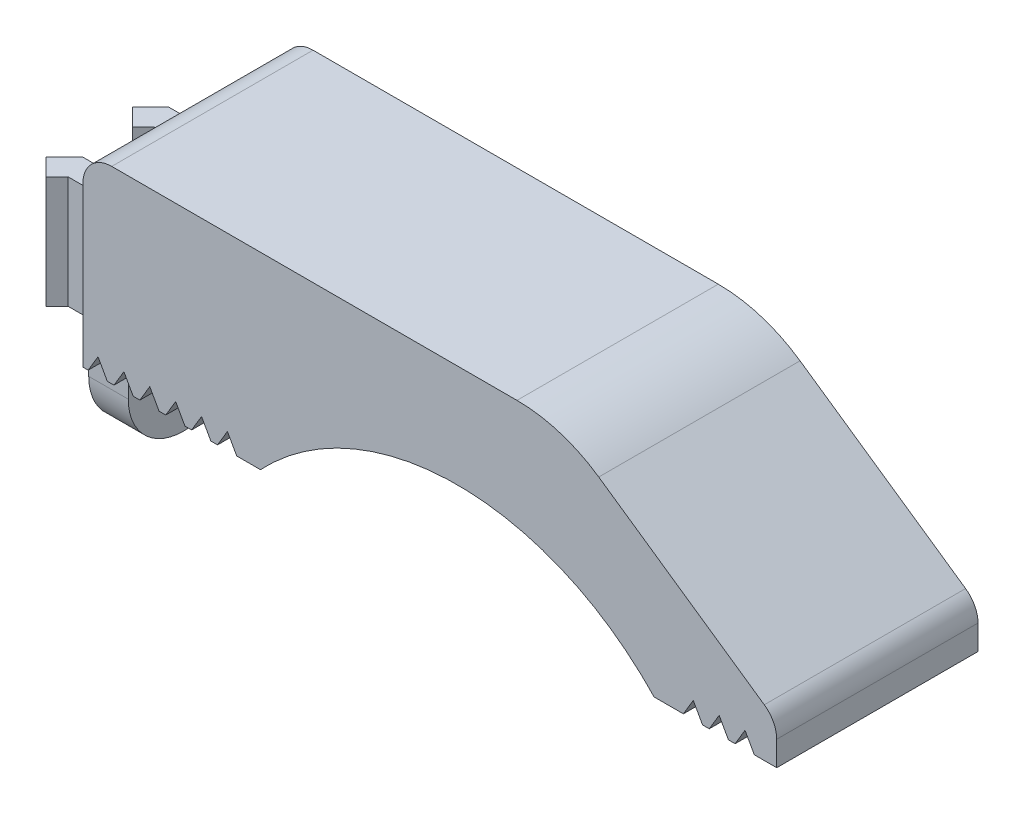
from build123d import *

# Parameters (mm, degrees)
EXTRUDE_1_DEPTH              = 10
CUT_EXTRUDE_1_DEPTH          = 34.383433003
FILLET_1_SIZE                = 4
FILLET_1_SIZE_2              = 6
CUT_EXTRUDE_2_DEPTH          = 34.383433056
CUT_EXTRUDE_2_DEPTH_BACK     = 34.383433056
SKETCH_3_W                   = 58.405721138
SKETCH_3_H                   = 2.2
SKETCH_4_W                   = 2.75
SKETCH_4_H                   = 7.7
EXTRUDE_2_DEPTH              = 7.35
SKETCH_5_R                   = 0.75
CUT_EXTRUDE_3_DEPTH          = 54.030431013
FILLET_2_R                   = 3.85
CORTAR_EXTRUIR1_DEPTH        = 33.791669707
SALIENTE_EXTRUIR1_DEPTH      = 7.7
CROQUIS2_R                   = 20
CORTAR_EXTRUIR3_DEPTH        = 35.438086687
SALIENTE_EXTRUIR4_DEPTH      = 7
SALIENTE_EXTRUIR4_DEPTH_BACK = 7
CORTAR_EXTRUIR4_DEPTH        = 37.368830262
REDONDEO3_R                  = 2
REDONDEO4_R                  = 10


# Some blends are built 0.0001 mm under size
with BuildPart() as part:
    # 草图1 → 凸台-拉伸1 (new body)
    with BuildSketch(Plane(origin=(0, 0, 0), x_dir=(1, 0, 0), z_dir=(0, 1, 0))):
        Polygon((27.5, 3.85), (-27.5, 3.85), (-29.64, 3.85), (-30.905721138, 2.584278862), (-29.70363961, 1.382197334), (-28.935836944, 2.15), (-27.5, 2.15), (-27.5, -2.15), (-29.64, -2.15), (-30.905721138, -3.415721138), (-29.70363961, -4.617802666), (-28.935836944, -3.85), (-27.5, -3.85), (27.5, -3.85), align=None)
    extrude(amount=EXTRUDE_1_DEPTH)

    # 草图2 → 切除-拉伸1 (cut, through all)
    with BuildSketch(Plane.XY.offset(3.85)):
        with BuildLine():
            Line((-18.935836944, 0), (21.5, 0))
            ThreePointArc((21.5, 0), (1.282081528, 3.70613757), (-18.935836944, 0))
        make_face()
    extrude(amount=-CUT_EXTRUDE_1_DEPTH, mode=Mode.SUBTRACT)

    # 圆角1
    # an asymmetric fillet: 6, 4 mm, written as the material it takes off along each edge
    with BuildSketch(Plane(origin=(27.5, 0, 18.85), x_dir=(-1, 0, 0), z_dir=(0, 0, -1))) as fillet_1_piece_1:
        with BuildLine():
            Bezier((FILLET_1_SIZE, 0), (0, 0), (0, FILLET_1_SIZE_2), weights=[1, 0.707106781, 1])
            Line((0, FILLET_1_SIZE_2), (0, 0))
            Line((0, 0), (FILLET_1_SIZE, 0))
        make_face()
    extrude(amount=37.7, mode=Mode.SUBTRACT)

    # 草图3 → 切除-拉伸2 (cut, two sides: drawn at the far end of the back side and taken through both)
    with BuildSketch(Plane.XY.offset(3.85).offset(-CUT_EXTRUDE_2_DEPTH_BACK)):
        with Locations((-1.702860569, 8.9)):
            Rectangle(SKETCH_3_W, SKETCH_3_H)
    extrude(amount=CUT_EXTRUDE_2_DEPTH + CUT_EXTRUDE_2_DEPTH_BACK, mode=Mode.SUBTRACT)

    # 草图4 → 凸台-拉伸2 (add)
    with BuildSketch(Plane.XZ):
        with Locations((-26.125, 0)):
            Rectangle(SKETCH_4_W, SKETCH_4_H)
    extrude(amount=EXTRUDE_2_DEPTH)

    # 草图5 → 切除-拉伸3 (cut, through all)
    with BuildSketch(Plane(origin=(-24.75, 0, 0), x_dir=(0, 0, -1), z_dir=(1, 0, 0))):
        with Locations((0, -3.5)):
            Circle(SKETCH_5_R)
    extrude(amount=-CUT_EXTRUDE_3_DEPTH, mode=Mode.SUBTRACT)

    # 圆角2
    fillet_2_edges = [part.edges().sort_by_distance(p)[0] for p in [
        (-26.125, -7.35, -3.85),
        (-26.125, -7.35, 3.85),
    ]]
    fillet(fillet_2_edges, radius=FILLET_2_R - 0.0001)  # a hair under: the kernel refuses the full size

    # Croquis1 → Cortar-Extruir1 (cut, through all)
    with BuildSketch(Plane.XY.offset(3.85)):
        with BuildLine():
            Line((27.5, 7.8), (16.217886534, 7.8))
            Line((16.217886534, 7.8), (23.5, 2.765439303))
            Line((23.5, 2.765439303), (23.5, 0))
            add(Edge.make_bspline(
                [(27.5, 6), (27.5, 5.69042848), (27.487576866, 5.380787378), (27.462721246, 5.071641684), (27.425314756, 4.763619555), (27.375158046, 4.457411018), (27.311958659, 4.153772273), (27.15893131, 3.554601129), (27.069254161, 3.259173226), (26.965810638, 2.96797603), (26.848060748, 2.682057947), (26.71538748, 2.402788295), (26.567124674, 2.131846167), (26.305522028, 1.71806679), (26.202980384, 1.568477856), (26.094611251, 1.422961788), (25.980267973, 1.282053299), (25.859832084, 1.146386576), (25.733223411, 1.016687557), (25.50418613, 0.80470891), (25.40471615, 0.719219867), (25.301997411, 0.637611459), (25.196057574, 0.56023543), (25.086963249, 0.487470604), (24.97482846, 0.419710585), (24.681074838, 0.260429148), (24.49523869, 0.176468902), (24.303178892, 0.107130148), (24.106026723, 0.053886894), (23.905206432, 0.017937167), (23.702478464, 0), (23.5, 0)],
                knots=[0, 0, 0, 0, 0, 0, 0, 0, 0.272858712, 0.272858712, 0.272858712, 0.272858712, 0.272858712, 0.272858712, 0.544533939, 0.544533939, 0.544533939, 0.544533939, 0.544533939, 0.544533939, 0.704314184, 0.704314184, 0.704314184, 0.704314184, 0.704314184, 0.704314184, 0.820075996, 0.820075996, 0.820075996, 0.820075996, 0.820075996, 0.820075996, 1, 1, 1, 1, 1, 1, 1, 1], degree=7))
            Line((27.5, 6), (27.5, 7.8))
        make_face()
    extrude(amount=-CORTAR_EXTRUIR1_DEPTH, mode=Mode.SUBTRACT)

    # Croquis1<3> → Saliente-Extruir1 (add)
    with BuildSketch(Plane.XY.offset(3.85)):
        Polygon((-24.75, 13.096878085), (-24.75, 7.8), (16.217886534, 7.8), (8.556350692, 13.096878085), align=None)
        with BuildLine():
            ThreePointArc((21.5, 0), (1.282081528, 3.70613757), (-18.935836944, 0))
            Line((-18.935836944, 0), (21.5, 0))
        make_face()
        with BuildLine():
            Line((-24.75, 7.8), (-24.75, 0))
            Line((-24.75, 0), (-18.935836944, 0))
            ThreePointArc((-18.935836944, 0), (1.282081528, 3.70613757), (21.5, 0))
            Line((21.5, 0), (23.5, 0))
            Line((23.5, 0), (23.5, 2.765439303))
            Line((23.5, 2.765439303), (16.217886534, 7.8))
            Line((16.217886534, 7.8), (-24.75, 7.8))
        make_face()
    extrude(amount=-SALIENTE_EXTRUIR1_DEPTH)

    # Croquis2 → Cortar-Extruir3 (cut, through all)
    with BuildSketch(Plane.XY.offset(3.85)):
        with Locations((1.282081528, -12.8)):
            Circle(CROQUIS2_R)
    extrude(amount=-CORTAR_EXTRUIR3_DEPTH, mode=Mode.SUBTRACT)

    # Croquis3 → Saliente-Extruir4 (add, two sides: drawn at the far end of the back side and taken through both)
    with BuildSketch(Plane.XY.offset(-SALIENTE_EXTRUIR4_DEPTH_BACK)):
        with BuildLine():
            ThreePointArc((16.649579698, 0), (1.282081528, 7.2), (-14.085416642, 0))
            Line((-14.085416642, 0), (-24.75, 0))
            Line((-24.75, 0), (-24.75, 7.8))
            Line((-24.75, 7.8), (-24.75, 13.096878085))
            Line((-24.75, 13.096878085), (8.556350692, 13.096878085))
            Line((8.556350692, 13.096878085), (23.5, 2.765439303))
            Line((23.5, 2.765439303), (23.5, 0))
            Line((23.5, 0), (16.649579698, 0))
        make_face()
        with BuildLine():
            Line((16.649579698, 0), (-14.085416642, 0))
            ThreePointArc((-14.085416642, 0), (1.282081528, 7.2), (16.649579698, 0))
        make_face()
    extrude(amount=SALIENTE_EXTRUIR4_DEPTH + SALIENTE_EXTRUIR4_DEPTH_BACK)

    # Croquis4 → Cortar-Revolución2 (revolve, cut)
    with BuildSketch(Plane.XY):
        with BuildLine():
            ThreePointArc((14.588399238, 2.131239365), (1.282081528, 7.2), (-12.024236182, 2.131239365))
            ThreePointArc((-12.024236182, 2.131239365), (1.282081528, 3.70613757), (14.588399238, 2.131239365))
        make_face()
        with BuildLine():
            ThreePointArc((-12.024236182, 2.131239365), (-13.094374036, 1.103867282), (-14.085416642, 0))
            Line((-14.085416642, 0), (16.649579698, 0))
            ThreePointArc((16.649579698, 0), (15.658537092, 1.103867282), (14.588399238, 2.131239365))
            ThreePointArc((14.588399238, 2.131239365), (1.282081528, 3.70613757), (-12.024236182, 2.131239365))
        make_face()
    revolve(axis=Axis((1.282081528, -12.8, 0), (-1, 0, 0)), mode=Mode.SUBTRACT)

    # Croquis5 → Cortar-Extruir4 (cut, through all)
    with BuildSketch(Plane.XY.offset(7)):
        Polygon((-22.59131667, 0), (-21.246710257, -0.018288841), (-21.903174863, 1.155318891), align=None)
        Polygon((-24.39131667, 0), (-23.046710257, -0.018288841), (-23.703174863, 1.155318891), align=None)
        Polygon((-20.79131667, 0), (-19.446710257, -0.018288841), (-20.103174863, 1.155318891), align=None)
        Polygon((-18.99131667, 0), (-17.646710257, -0.018288841), (-18.303174863, 1.155318891), align=None)
        Polygon((-17.19131667, 0), (-15.846710257, -0.018288841), (-16.503174863, 1.155318891), align=None)
        Polygon((-15.39131667, 0), (-14.046710257, -0.018288841), (-14.703174863, 1.155318891), align=None)
        Polygon((17.00868333, 0), (18.353289743, -0.018288841), (17.696825137, 1.155318891), align=None)
        Polygon((18.80868333, 0), (20.153289743, -0.018288841), (19.496825137, 1.155318891), align=None)
        Polygon((20.60868333, 0), (21.953289743, -0.018288841), (21.296825137, 1.155318891), align=None)
    extrude(amount=-CORTAR_EXTRUIR4_DEPTH, mode=Mode.SUBTRACT)

    # Redondeo3
    redondeo3_edges = [part.edges().sort_by_distance(p)[0] for p in [
        (23.5, 2.765439303, 0),
        (-24.75, 13.096878085, 0),
    ]]
    fillet(redondeo3_edges, radius=REDONDEO3_R)

    # Redondeo4
    redondeo4_edges = [part.edges().sort_by_distance(p)[0] for p in [
        (8.556350692, 13.096878085, 0),
    ]]
    fillet(redondeo4_edges, radius=REDONDEO4_R)


solid = part.part
